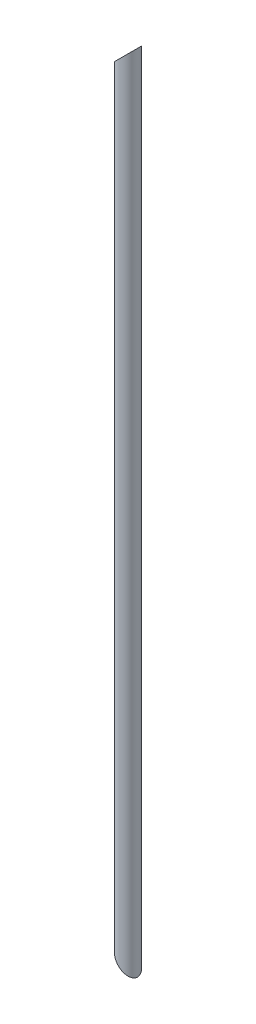
from build123d import *

# Parameters (mm, degrees)
ESBO_O2_W                  = 31.75
ESBO_O2_H                  = 2670
CORTE_EXTRUS_O1_DEPTH      = 2671.377524808
CORTE_EXTRUS_O1_DEPTH_BACK = 2671.377524808
ESBO_O9_R                  = 30.75
CORTE_EXTRUS_O6_DEPTH      = 2671.377524808


with BuildPart() as part:
    # Esboço2 → Revolução2 (revolve)
    with BuildSketch(Plane.XY):
        with Locations((15.875, 1335)):
            Rectangle(ESBO_O2_W, ESBO_O2_H)
    revolve(axis=Axis((0, 0, 0), (0, 1, 0)))

    # Esboço3 → Corte-extrusão1 (cut, two sides: drawn at the far end of the back side and taken through both)
    with BuildSketch(Plane.XY.offset(-CORTE_EXTRUS_O1_DEPTH_BACK)):
        Polygon((-31.75, 2670), (31.75, 2670), (-31.75, 2606.5), align=None)
        Polygon((31.75, 0), (-31.75, 63.5), (-31.75, 0), align=None)
    extrude(amount=CORTE_EXTRUS_O1_DEPTH + CORTE_EXTRUS_O1_DEPTH_BACK, mode=Mode.SUBTRACT)

    # Esboço9 → Corte-extrusão6 (cut, through all)
    with BuildSketch(Plane(origin=(0, 0, 0), x_dir=(1, 0, 0), z_dir=(0, 1, 0))):
        Circle(ESBO_O9_R)
    extrude(amount=CORTE_EXTRUS_O6_DEPTH, mode=Mode.SUBTRACT)


solid = part.part
